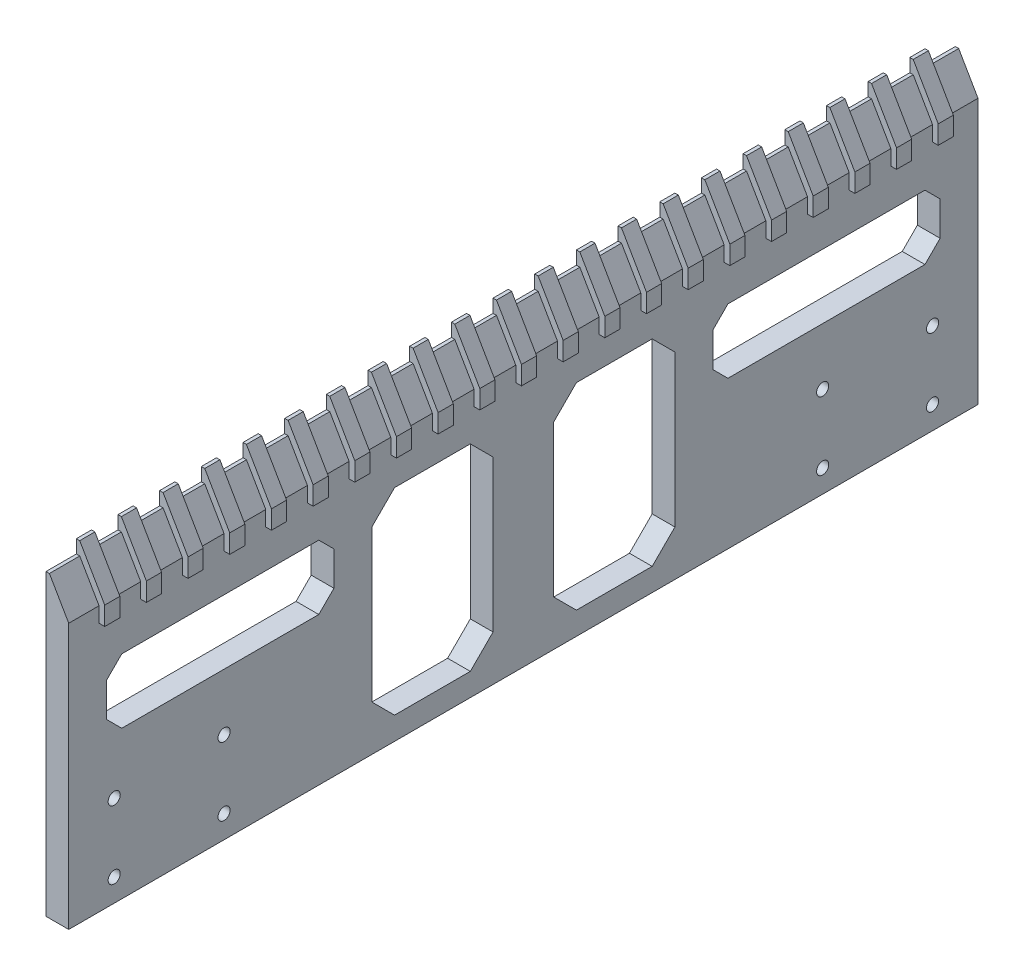
from build123d import *

# Parameters (mm, degrees)
SKETCH_1_W                  = 240
SKETCH_1_H                  = 70
EXTRUDE_1_DEPTH             = 6
CUT_EXTRUDE_2_DEPTH         = 251.071989635
EXTRUDE_2_DEPTH             = 240
EXTRUDE_3_DEPTH             = 2
PATTERN_LINEAR_1_COUNT      = 11
PATTERN_LINEAR_1_PITCH      = 11
PATTERN_LINEAR_1_COUNT_DIR2 = 11
PATTERN_LINEAR_1_PITCH_DIR2 = 11
HOLE_WIZARD_1_D             = 3.2
HOLE_WIZARD_1_CBORE_D       = 6
HOLE_WIZARD_1_CBORE_DEPTH   = 3.4


with BuildPart() as part:
    # 草图1 → 凸台-拉伸1 (new body)
    with BuildSketch(Plane(origin=(0, 0, 0), x_dir=(0, 0, -1), z_dir=(1, 0, 0))):
        with Locations((120, -35)):
            Rectangle(SKETCH_1_W, SKETCH_1_H)
    extrude(amount=EXTRUDE_1_DEPTH)

    # 草图3 → 切除-拉伸2 (cut, through all)
    with BuildSketch(Plane(origin=(6, 0, 0), x_dir=(0, 0, -1), z_dir=(1, 0, 0))):
        Polygon((14, -14), (66, -14), (70, -18), (70, -27), (66, -31), (14, -31), (10, -27), (10, -18), align=None)
        Polygon((80, -18), (86, -12), (106, -12), (112, -18), (112, -58), (106, -64), (86, -64), (80, -58), align=None)
    cut_extrude_2 = extrude(amount=-CUT_EXTRUDE_2_DEPTH, mode=Mode.SUBTRACT)

    # 草图6 → 凸台-拉伸2 (add)
    with BuildSketch(Plane.XY):
        Polygon((6, 0), (0, 0), (0, 8.833459119), (0.9, 8.833459119), align=None)
    extrude(amount=-EXTRUDE_2_DEPTH)

    # 草图8 → 凸台-拉伸3 (add, symmetric)
    with BuildSketch(Plane.XY.offset(-120)):
        Polygon((0, 10.392304845), (0, 12.333459119), (0.9, 12.333459119), (7.5, 0.901923789), (7.5, -4), (6, -4), (6, 0), (0.9, 8.833459119), (0, 8.833459119), align=None)
    extrude_3 = extrude(amount=EXTRUDE_3_DEPTH, both=True)

    # 阵列(线性)1: Extrude 3 11 × 11
    with Locations(*[Vector(0, 0, 1) * (i * PATTERN_LINEAR_1_PITCH) + Vector(0, 0, -1) * (j * PATTERN_LINEAR_1_PITCH_DIR2) for i in range(PATTERN_LINEAR_1_COUNT) for j in range(PATTERN_LINEAR_1_COUNT_DIR2) if (i, j) != (0, 0)]):
        add(extrude_3)

    # 打孔尺寸(%根据)内六角圆柱头螺钉的类型1 (through all)
    with Locations(Plane.ZY):
        with Locations((-41, -46), (-12, -46), (-12, -64), (-41, -64)):
            hole_wizard_1 = CounterBoreHole(HOLE_WIZARD_1_D / 2, HOLE_WIZARD_1_CBORE_D / 2, HOLE_WIZARD_1_CBORE_DEPTH)

    # 镜向1: 打孔尺寸(%根据)内六角圆柱头螺钉的类型1 across plane
    add(hole_wizard_1.mirror(Plane.XY.offset(-120)), mode=Mode.SUBTRACT)

    # 镜向2: 切除-拉伸2 across plane
    add(cut_extrude_2.mirror(Plane.XY.offset(-120)), mode=Mode.SUBTRACT)


solid = part.part
